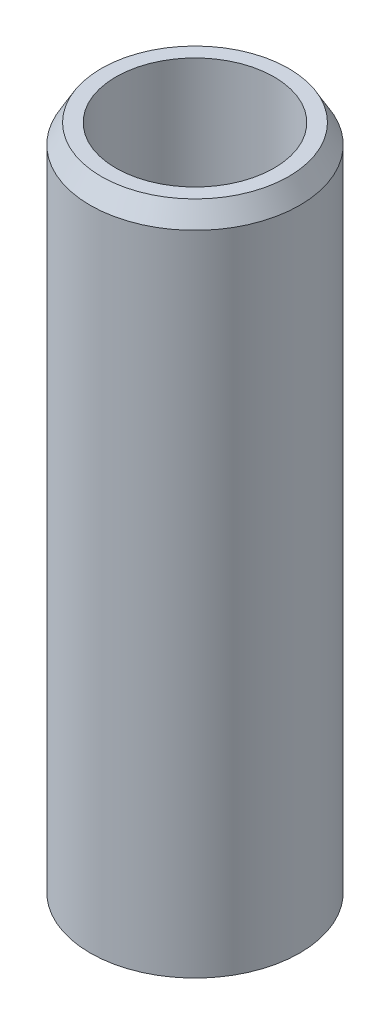
from build123d import *
from OCP.BRepFilletAPI import BRepFilletAPI_MakeChamfer

# Parameters (mm, degrees)
SKETCH1_R           = 32.5
BOSS_EXTRUDE1_DEPTH = 210.218991265
SKETCH2_R           = 24.521317167
CUT_EXTRUDE1_DEPTH  = 216.184860732
CHAMFER1_SIZE       = 5.985245049
CHAMFER1_SIZE2      = 3.45558284


with BuildPart() as part:
    # Sketch1 → Boss-Extrude1 (new body)
    with BuildSketch(Plane(origin=(0, 0, 0), x_dir=(1, 0, 0), z_dir=(0, 1, 0))):
        Circle(SKETCH1_R)
    extrude(amount=BOSS_EXTRUDE1_DEPTH)

    # Sketch2 → Cut-Extrude1 (cut, through all)
    with BuildSketch(Plane(origin=(0, 0, 0), x_dir=(1, 0, 0), z_dir=(0, 1, 0))):
        Circle(SKETCH2_R)
    extrude(amount=CUT_EXTRUDE1_DEPTH, mode=Mode.SUBTRACT)

    # Chamfer1: one chamfer whose edges measure the first distance from different faces: ONE call of the kernel's chamfer builder (chamfer() names one face for all edges)
    chamfer1_edges_1 = [part.edges().sort_by_distance(p)[0] for p in [
        (-32.5, 210.218991265, 0),
    ]]
    chamfer1_side_1 = [part.faces().sort_by_distance(p)[0] for p in [
        (-32.5, 105.109495632, 0),
    ]]
    chamfer1_edges_2 = [part.edges().sort_by_distance(p)[0] for p in [
        (-32.5, 0, 0),
    ]]
    chamfer1_side_2 = [part.faces().sort_by_distance(p)[0] for p in [
        (-31.580761184, 0, 0),
    ]]
    chamfer1 = BRepFilletAPI_MakeChamfer(part.part.solid().wrapped)
    for e in chamfer1_edges_1:
        chamfer1.Add(CHAMFER1_SIZE, CHAMFER1_SIZE2, e.wrapped, chamfer1_side_1[0].wrapped)  # the first distance lies on this face
    for e in chamfer1_edges_2:
        chamfer1.Add(CHAMFER1_SIZE, CHAMFER1_SIZE2, e.wrapped, chamfer1_side_2[0].wrapped)  # the first distance lies on this face
    add(Compound.cast(chamfer1.Shape()), mode=Mode.REPLACE)


solid = part.part
